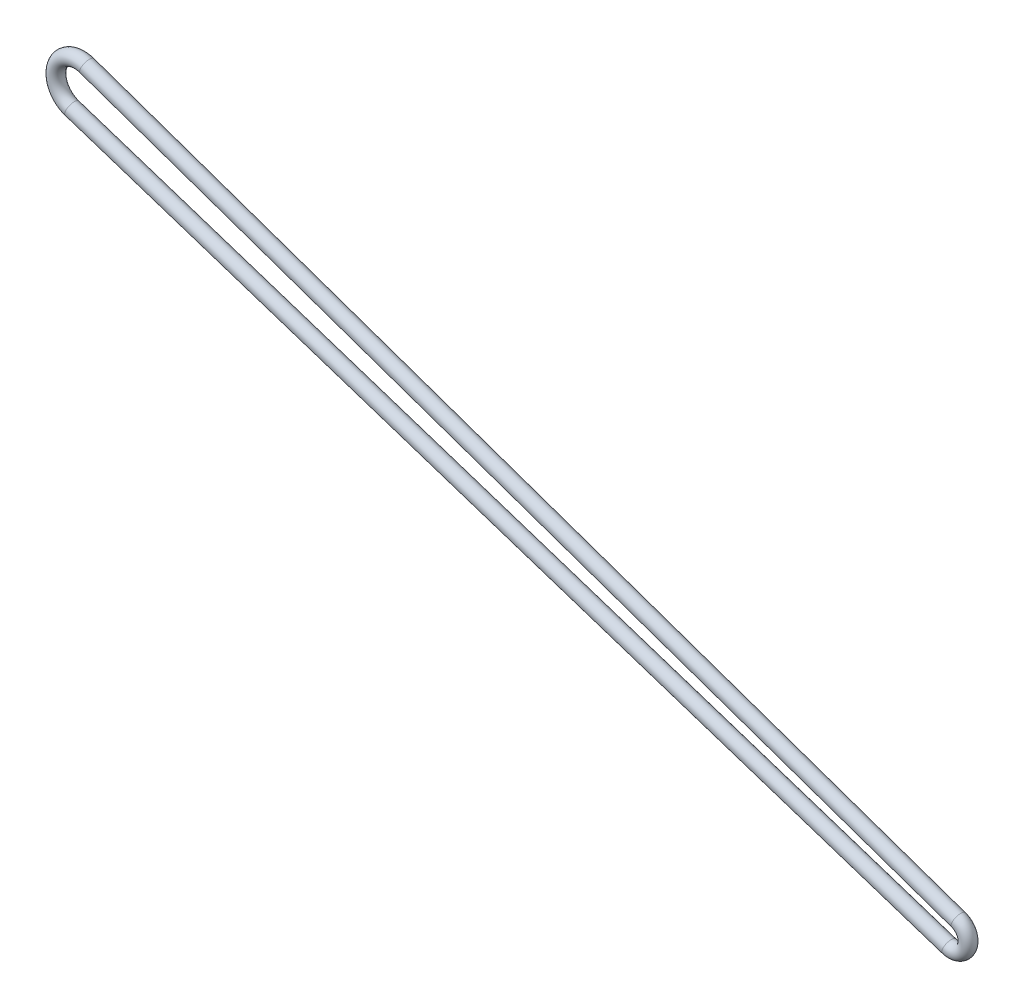
from build123d import *

# Parameters (mm, degrees)
SWEEP_19_PROFILE_R = 1.5


with BuildPart() as part:
    # 扫描19: sweep along a path in 草图2
    with BuildLine(Plane.XY) as sweep_19_path:
        Line((291.735448535, 75.037911311), (104.27135597, 136.39293503))
        ThreePointArc((104.27135597, 136.39293503), (101.089861854, 142.745863271), (107.47313967, 145.866018135))
        Line((107.47313967, 145.866018135), (293.720554429, 80.911222836))
        ThreePointArc((293.720554429, 80.911222836), (295.636506179, 76.991528835), (291.735448535, 75.037911311))
    # 扫描19 profile (on start of the path) → 扫描19 (sweep)
    with BuildSketch(Plane(origin=(291.735448535, 75.037911311, 0), x_dir=(-0.3110534341192455, -0.9503924248028413, 0), z_dir=(-0.9503924248028413, 0.3110534341192455, 0))):
        Circle(SWEEP_19_PROFILE_R)
    sweep(path=sweep_19_path.line)


solid = part.part
